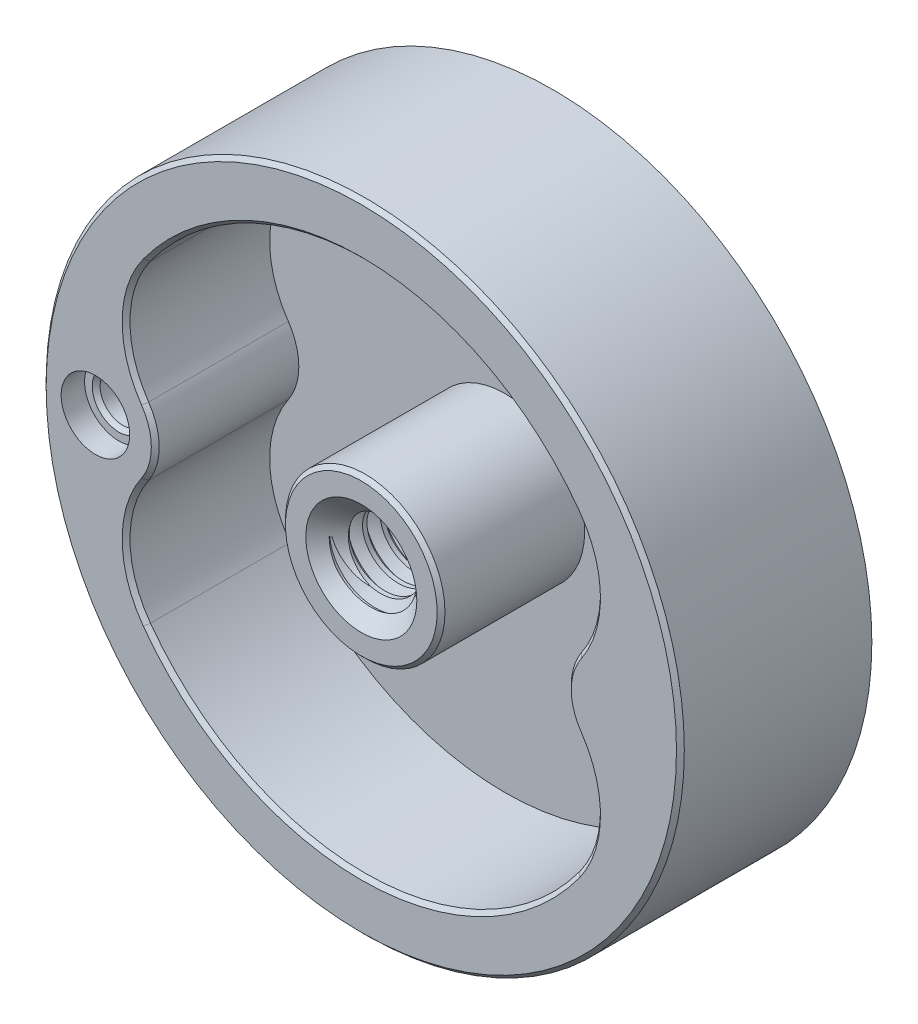
from build123d import *

# Parameters (mm, degrees)
SKETCH1_R                 = 19.05
BOSS_EXTRUDE1_DEPTH       = 11.43
F_6_32_TAPPED_HOLE1_D     = 2.7051
F_6_32_TAPPED_HOLE1_DEPTH = 9.09330597
F_6_32_TAPPED_HOLE1_TIP   = 0.81269403
SKETCH4_R                 = 8.255
CUT_EXTRUDE1_DEPTH        = 1.27
SKETCH11_R                = 4.7625
CUT_EXTRUDE4_DEPTH        = 8.5725
FILLET1_R                 = 6.35
SKETCH18_R                = 2.0447
CUT_EXTRUDE8_DEPTH        = 56.445355206
SKETCH8_R                 = 3.1877
COUNTERBORE_DEPTH         = 2.54
SKETCH16_R                = 2.0447
CUT_EXTRUDE7_DEPTH        = 1.397
CHAMFER2_SIZE             = 0.23368
CHAMFER3_SIZE             = 1.27
THREAD2_PITCH             = 1.058333333


with BuildPart() as part:
    # Sketch1 → Boss-Extrude1 (new body)
    with BuildSketch(Plane.XY):
        with Locations((31.75, 0)):
            Circle(SKETCH1_R)
    extrude(amount=BOSS_EXTRUDE1_DEPTH)

    # #6-32 Tapped Hole1
    with Locations(Plane.XY.offset(11.43)):
        with Locations((15.875, 0)):
            Hole(F_6_32_TAPPED_HOLE1_D / 2, depth=F_6_32_TAPPED_HOLE1_DEPTH)
            with Locations((0, 0, -(F_6_32_TAPPED_HOLE1_DEPTH + F_6_32_TAPPED_HOLE1_TIP / 2))):  # 118° drill point
                Cone(0, F_6_32_TAPPED_HOLE1_D / 2, F_6_32_TAPPED_HOLE1_TIP, mode=Mode.SUBTRACT)

    # Sketch4 → Cut-Extrude1 (cut)
    with BuildSketch(Plane(origin=(0, 0, 0), x_dir=(-1, 0, 0), z_dir=(0, 0, -1))):
        with Locations((-31.75, 0)):
            Circle(SKETCH4_R)
    extrude(amount=-CUT_EXTRUDE1_DEPTH, mode=Mode.SUBTRACT)

    # Sketch11 → Cut-Extrude4 (cut)
    with BuildSketch(Plane.XY.offset(11.43)):
        with BuildLine():
            ThreePointArc((16.276835937, -3.549199754), (31.75, -15.875), (47.223164062, -3.549199754))
            ThreePointArc((47.223164062, -3.549199754), (44.053125, 0), (47.223164062, 3.549199754))
            ThreePointArc((47.223164062, 3.549199754), (31.75, 15.875), (16.276835937, 3.549199754))
            ThreePointArc((16.276835937, 3.549199754), (19.446875, 0), (16.276835937, -3.549199754))
        make_face()
        with Locations((31.75, 0)):
            Circle(SKETCH11_R, mode=Mode.SUBTRACT)
    extrude(amount=-CUT_EXTRUDE4_DEPTH, mode=Mode.SUBTRACT)

    # Fillet1
    fillet1_edges = [part.edges().sort_by_distance(p)[0] for p in [
        (16.276835937, 3.549199754, 7.14375),
        (47.223164062, 3.549199754, 7.14375),
        (47.223164062, -3.549199754, 7.14375),
        (16.276835937, -3.549199754, 7.14375),
    ]]
    fillet(fillet1_edges, radius=FILLET1_R)

    # Sketch18 → Cut-Extrude8 (cut, through all)
    with BuildSketch(Plane.XY.offset(11.43)):
        with Locations((31.75, 0)):
            Circle(SKETCH18_R)
    extrude(amount=-CUT_EXTRUDE8_DEPTH, mode=Mode.SUBTRACT)

    # Sketch8 → Counterbore (cut)
    with BuildSketch(Plane(origin=(0, 0, 0), x_dir=(-1, 0, 0), z_dir=(0, 0, -1))):
        with Locations((-31.75, 0)):
            Circle(SKETCH8_R)
    extrude(amount=-COUNTERBORE_DEPTH, mode=Mode.SUBTRACT)

    # Sketch16 → Cut-Extrude7 (cut)
    with BuildSketch(Plane.XY.offset(11.43)):
        with Locations((15.875, 0)):
            Circle(SKETCH16_R)
    extrude(amount=-CUT_EXTRUDE7_DEPTH, mode=Mode.SUBTRACT)

    # Chamfer2
    chamfer2_edges = [part.edges().sort_by_distance(p)[0] for p in [
        (26.9875, 0, 11.43),
        (31.75, 15.875, 11.43),
        (44.053125, 0, 11.43),
        (31.75, -15.875, 11.43),
        (19.446875, 0, 11.43),
        (45.793751743, 5.706123188, 11.43),
        (45.793751743, -5.706123188, 11.43),
        (17.706248257, 5.706123188, 11.43),
        (17.706248257, -5.706123188, 11.43),
        (12.7, 0, 11.43),
        (17.22755, 0, 10.033),
    ]]
    chamfer(chamfer2_edges, length=CHAMFER2_SIZE)

    # Chamfer3
    chamfer3_edges = [part.edges().sort_by_distance(p)[0] for p in [
        (29.7053, 0, 11.43),
    ]]
    chamfer(chamfer3_edges, length=CHAMFER3_SIZE)

    # Thread2: the profile of Thread Profile2 profile screwed along a left-hand helix of 10.544882 turns, 8 arcs to a turn; built about Z, then put on its axis
    thread2_z = Axis((0, 0, 0), (0, 0, 1))
    thread2_corners = [(2.0444, 0, -0.000173205), (2.617539718, 0, 0.330729165), (2.617539718, 0, 0.463020832), (2.0444, 0, 0.793923202)]
    with BuildLine(mode=Mode.PRIVATE) as thread2_profile:
        Line(thread2_corners[0], thread2_corners[1])
        Line(thread2_corners[1], thread2_corners[2])
        Line(thread2_corners[2], thread2_corners[3])
        Line(thread2_corners[3], thread2_corners[0])
    thread2_cap = Face(thread2_profile.wire())
    thread2_turn_angles = [0, -22.5, -45, -67.5, -90, -112.5, -135, -157.5, -180, -202.5, -225, -247.5, -270, -292.5, -315, -337.5, -360]
    thread2_turn_weights = [1, 0.9238795325112867, 1, 0.9238795325112867, 1, 0.9238795325112867, 1, 0.9238795325112867, 1, 0.9238795325112867, 1, 0.9238795325112867, 1, 0.9238795325112867, 1, 0.9238795325112867, 1]
    thread2_turn_rails = [Edge.make_bspline([Vector(p[0], p[1], 0).rotate(thread2_z, thread2_turn_angles[k]) / thread2_turn_weights[k] + Vector(0, 0, p[2] + -THREAD2_PITCH * thread2_turn_angles[k] / 360) for k in range(17)], [0, 0, 0, 1, 1, 2, 2, 3, 3, 4, 4, 5, 5, 6, 6, 7, 7, 8, 8, 8], 2, thread2_turn_weights) for p in thread2_corners]
    thread2_turn_sides = [Face.make_surface_from_curves(thread2_turn_rails[p[0]], thread2_turn_rails[p[1]]) for p in [(0, 1), (1, 2), (2, 3), (3, 0)]]
    thread2_last_angles = [-3600, -3622.5, -3645, -3667.5, -3690, -3712.5, -3735, -3757.5, -3780, -3788.078740157, -3796.157480315]
    thread2_last_weights = [1, 0.9238795325112867, 1, 0.9238795325112867, 1, 0.9238795325112867, 1, 0.9238795325112867, 1, 0.9900758715625, 1]
    thread2_last_rails = [Edge.make_bspline([Vector(p[0], p[1], 0).rotate(thread2_z, thread2_last_angles[k]) / thread2_last_weights[k] + Vector(0, 0, p[2] + -THREAD2_PITCH * thread2_last_angles[k] / 360) for k in range(11)], [0, 0, 0, 1, 1, 2, 2, 3, 3, 4, 4, 5, 5, 5], 2, thread2_last_weights) for p in thread2_corners]
    thread2_last_sides = [Face.make_surface_from_curves(thread2_last_rails[p[0]], thread2_last_rails[p[1]]) for p in [(0, 1), (1, 2), (2, 3), (3, 0)]]
    thread2 = Plane(origin=(31.75, 0, 11.16), x_dir=(-1, 0, 0), z_dir=(0, 0, -1)) * Solid(Shell([*[p.moved(Location((0, 0, THREAD2_PITCH * i))) for i in range(10) for p in thread2_turn_sides], *thread2_last_sides, thread2_cap, thread2_cap.rotate(thread2_z, -3796.157480315).moved(Location((0, 0, -THREAD2_PITCH * -3796.157480315 / 360)))]))
    add(thread2, mode=Mode.SUBTRACT)


solid = part.part
